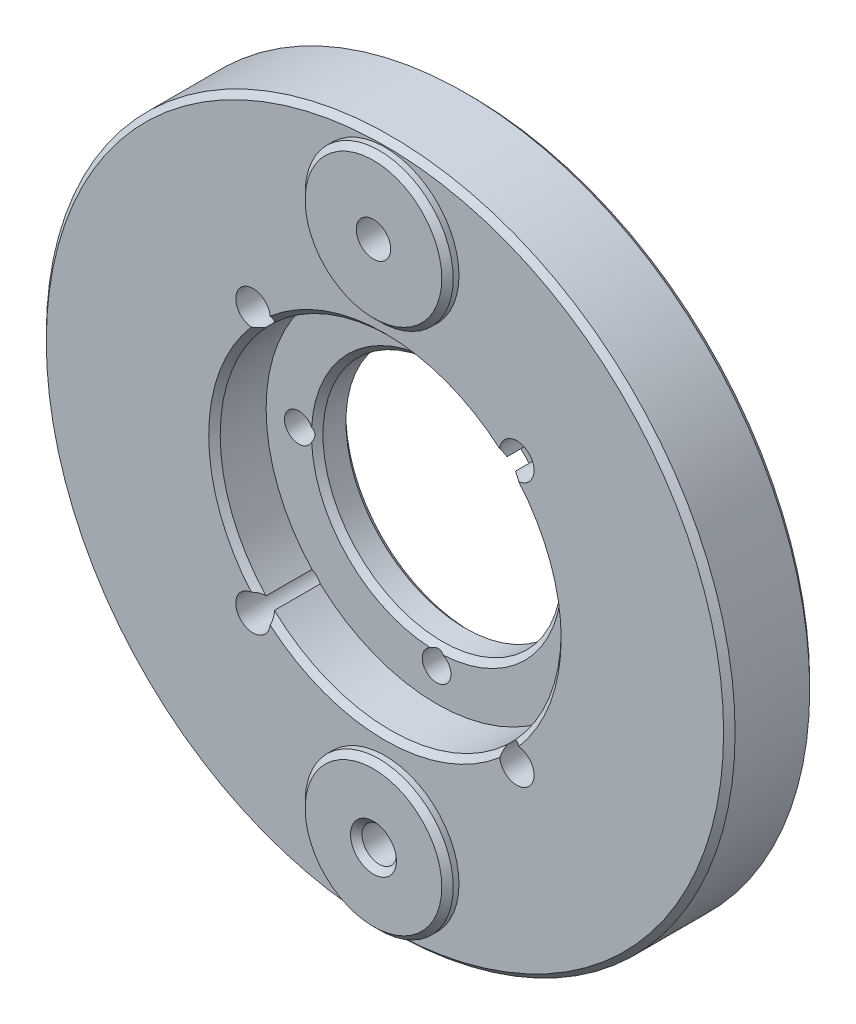
from build123d import *

# Parameters (mm, degrees)
SKETCH1_R               = 29.7
SKETCH1_R_2             = 20.8
BOSS_EXTRUDE1_DEPTH     = 6
SKETCH3_R               = 60
SKETCH3_R_2             = 29.7
BOSS_EXTRUDE2_DEPTH     = 15
CUT_EXTRUDE1_DEPTH      = 87.168439698
CUT_EXTRUDE1_DEPTH_BACK = 87.168439698
SKETCH4_R               = 3
CUT_EXTRUDE3_DEPTH      = 87.168439698
CUT_EXTRUDE3_DEPTH_BACK = 87.168439698
SKETCH2_R               = 2.5
SKETCH5_R               = 12.9
SKETCH5_R_2             = 3
BOSS_EXTRUDE3_DEPTH     = 2
CUT_EXTRUDE4_DEPTH      = 87.168439698
CUT_EXTRUDE4_DEPTH_BACK = 87.168439698
SKETCH5_2_R             = 3
CHAMFER1_SIZE           = 1


with BuildPart() as part:
    # Sketch1 → Boss-Extrude1 (new body)
    with BuildSketch(Plane.XY):
        Circle(SKETCH1_R)
        Circle(SKETCH1_R_2, mode=Mode.SUBTRACT)
    extrude(amount=BOSS_EXTRUDE1_DEPTH)

    # Sketch3 → Boss-Extrude2 (add)
    with BuildSketch(Plane.XY):
        with Locations(Location((0, 0, 0), (0, 0, 180))):
            Circle(SKETCH3_R)
        with Locations(Location((0, 0, 0), (0, 0, 180))):
            Circle(SKETCH3_R_2, mode=Mode.SUBTRACT)
    extrude(amount=BOSS_EXTRUDE2_DEPTH)

    # Sketch4 → Cut-Extrude1 (cut, two sides: drawn at the far end of the back side and taken through both)
    with BuildSketch(Plane.XY.offset(-CUT_EXTRUDE1_DEPTH_BACK)):
        with Locations(Location((-22.980970389, 22.980970389, 0), (0, 0, 294.931333751))):
            Circle(SKETCH4_R)
        with Locations(Location((22.980970389, 22.980970389, 0), (0, 0, 204.931333751))):
            Circle(SKETCH4_R)
        with Locations(Location((22.980970389, -22.980970389, 0), (0, 0, 155.068666249))):
            Circle(SKETCH4_R)
        with Locations(Location((-22.980970389, -22.980970389, 0), (0, 0, 65.068666249))):
            Circle(SKETCH4_R)
    extrude(amount=CUT_EXTRUDE1_DEPTH + CUT_EXTRUDE1_DEPTH_BACK, mode=Mode.SUBTRACT)

    # Sketch2 → Cut-Extrude3 (cut, two sides: drawn at the far end of the back side and taken through both)
    with BuildSketch(Plane.XY.offset(-CUT_EXTRUDE3_DEPTH_BACK)):
        with Locations((0, 24)):
            Circle(SKETCH2_R)
        with Locations((24, 0)):
            Circle(SKETCH2_R)
        with Locations((0, -24)):
            Circle(SKETCH2_R)
        with Locations((-24, 0)):
            Circle(SKETCH2_R)
    extrude(amount=CUT_EXTRUDE3_DEPTH + CUT_EXTRUDE3_DEPTH_BACK, mode=Mode.SUBTRACT)

    # Sketch5 → Boss-Extrude3 (add)
    # profile 1 of 2: a face of its own
    with BuildSketch(Plane.XY.offset(15)):
        with Locations((0, 45.9)):
            Circle(SKETCH5_R)
        with Locations((0, 45.9)):
            Circle(SKETCH5_R_2, mode=Mode.SUBTRACT)
    # profile 2 of 2: a face of its own
    with BuildSketch(Plane.XY.offset(15)):
        with Locations((0, -45.9)):
            Circle(SKETCH5_R)
        with Locations((0, -45.9)):
            Circle(SKETCH5_R_2, mode=Mode.SUBTRACT)
    extrude(amount=BOSS_EXTRUDE3_DEPTH)

    # Sketch5<2> → Cut-Extrude4 (cut, two sides: drawn at the far end of the back side and taken through both)
    with BuildSketch(Plane.XY.offset(15).offset(-CUT_EXTRUDE4_DEPTH_BACK)):
        with Locations((0, 45.9)):
            Circle(SKETCH5_2_R)
        with Locations((0, -45.9)):
            Circle(SKETCH5_2_R)
    extrude(amount=CUT_EXTRUDE4_DEPTH + CUT_EXTRUDE4_DEPTH_BACK, mode=Mode.SUBTRACT)

    # Chamfer1
    # the kernel refuses this chamfer: 1 mm, written as the material it takes off along each edge
    with BuildSketch(Plane(origin=(0, 0, 0), x_dir=(-1, 0, 0), z_dir=(0, 1, 0))) as chamfer1_piece_1:
        Polygon((60 - CHAMFER1_SIZE, 0), (60, CHAMFER1_SIZE), (60, 0), align=None)
    revolve(axis=Axis((0, 0, 0), (0, 0, 1)), mode=Mode.SUBTRACT)
    with BuildSketch(Plane(origin=(0, 0, 15), x_dir=(-1, 0, 0), z_dir=(0, 1, 0))) as chamfer1_piece_2:
        Polygon((60, -CHAMFER1_SIZE), (60 - CHAMFER1_SIZE, 0), (60, 0), align=None)
    revolve(axis=Axis((0, 0, 15), (0, 0, 1)), mode=Mode.SUBTRACT)
    with BuildSketch(Plane(origin=(0, 0, 15), x_dir=(0.742872020210988, 0.6694334631519742, 0), z_dir=(0.6694334631519742, -0.742872020210988, 0))) as chamfer1_piece_3:
        Polygon((29.7, -CHAMFER1_SIZE), (29.7 + CHAMFER1_SIZE, 0), (29.7, 0), align=None)
    revolve(axis=Axis((0, 0, 15), (0, 0, 1)), revolution_arc=95.953291469, mode=Mode.SUBTRACT)
    with BuildSketch(Plane(origin=(0, 0, 15), x_dir=(-0.6694334631519382, 0.7428720202110204, 0), z_dir=(0.7428720202110204, 0.6694334631519382, 0))) as chamfer1_piece_4:
        Polygon((29.7, -CHAMFER1_SIZE), (29.7 + CHAMFER1_SIZE, 0), (29.7, 0), align=None)
    revolve(axis=Axis((0, 0, 15), (0, 0, 1)), revolution_arc=95.953291469, mode=Mode.SUBTRACT)
    with BuildSketch(Plane(origin=(0, 0, 15), x_dir=(-0.7428720202113098, -0.6694334631516169, 0), z_dir=(-0.6694334631516169, 0.7428720202113098, 0))) as chamfer1_piece_5:
        Polygon((29.7, -CHAMFER1_SIZE), (29.7 + CHAMFER1_SIZE, 0), (29.7, 0), align=None)
    revolve(axis=Axis((0, 0, 15), (0, 0, 1)), revolution_arc=95.953291469, mode=Mode.SUBTRACT)
    with BuildSketch(Plane(origin=(0, 0, 15), x_dir=(0.6694334631516162, -0.7428720202113106, 0), z_dir=(-0.7428720202113106, -0.6694334631516162, 0))) as chamfer1_piece_6:
        Polygon((29.7, -CHAMFER1_SIZE), (29.7 + CHAMFER1_SIZE, 0), (29.7, 0), align=None)
    revolve(axis=Axis((0, 0, 15), (0, 0, 1)), revolution_arc=95.95329147, mode=Mode.SUBTRACT)
    with BuildSketch(Plane(origin=(0, 0, 0), x_dir=(1, 0, 0), z_dir=(0, -1, 0))) as chamfer1_piece_7:
        Polygon((20.8, CHAMFER1_SIZE), (20.8 + CHAMFER1_SIZE, 0), (20.8, 0), align=None)
    revolve(axis=Axis((0, 0, 0), (0, 0, 1)), mode=Mode.SUBTRACT)
    with BuildSketch(Plane(origin=(0, 0, 6), x_dir=(1, 0, 0), z_dir=(0, -1, 0))) as chamfer1_piece_8:
        Polygon((20.8, -CHAMFER1_SIZE), (20.8 + CHAMFER1_SIZE, 0), (20.8, 0), align=None)
    revolve(axis=Axis((0, 0, 6), (0, 0, 1)), mode=Mode.SUBTRACT)
    with BuildSketch(Plane(origin=(0, 45.9, 17), x_dir=(1, 0, 0), z_dir=(0, -1, 0))) as chamfer1_piece_9:
        Polygon((12.9, -CHAMFER1_SIZE), (12.9 - CHAMFER1_SIZE, 0), (12.9, 0), align=None)
    revolve(axis=Axis((0, 45.9, 17), (0, 0, 1)), mode=Mode.SUBTRACT)
    with BuildSketch(Plane(origin=(0, -45.9, 17), x_dir=(1, 0, 0), z_dir=(0, -1, 0))) as chamfer1_piece_10:
        Polygon((12.9, -CHAMFER1_SIZE), (12.9 - CHAMFER1_SIZE, 0), (12.9, 0), align=None)
    revolve(axis=Axis((0, -45.9, 17), (0, 0, 1)), mode=Mode.SUBTRACT)
    with BuildSketch(Plane(origin=(0, -45.9, 17), x_dir=(1, 0, 0), z_dir=(0, -1, 0))) as chamfer1_piece_11:
        Polygon((3, -CHAMFER1_SIZE), (3 + CHAMFER1_SIZE, 0), (3, 0), align=None)
    revolve(axis=Axis((0, -45.9, 17), (0, 0, 1)), mode=Mode.SUBTRACT)


solid = part.part
